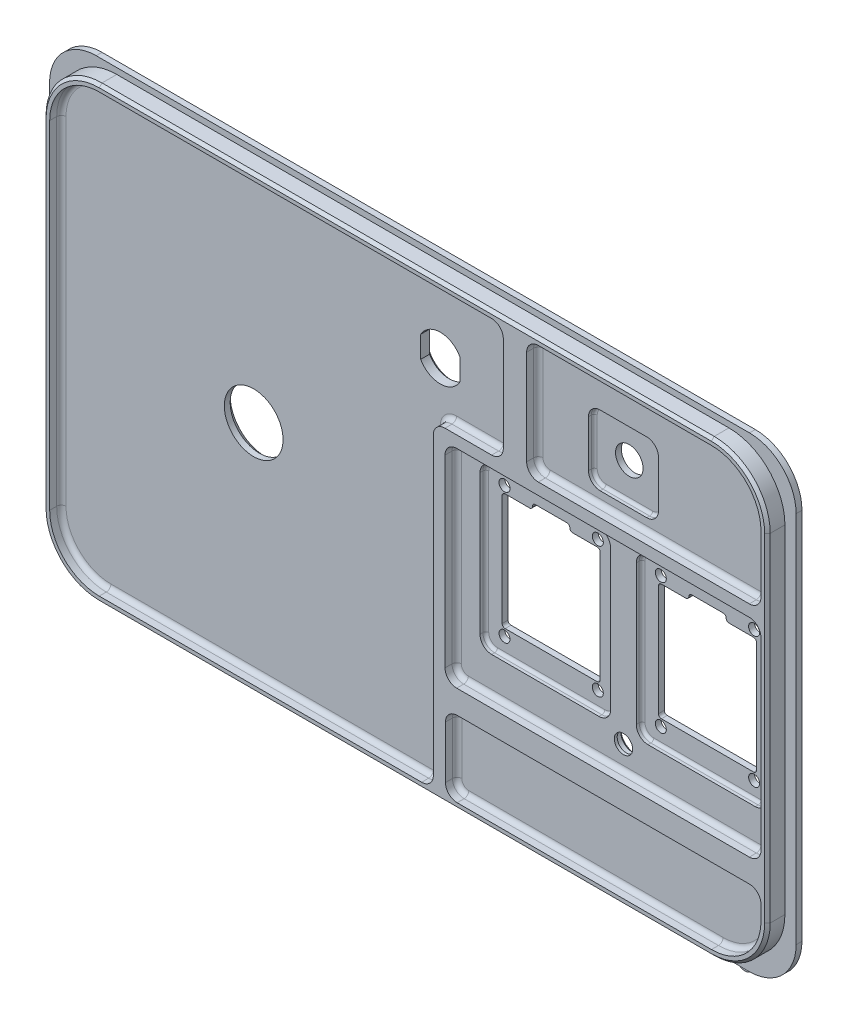
from build123d import *

# Parameters (mm, degrees)
SKETCH2_W           = 203.2
SKETCH2_H           = 127
BOSS_EXTRUDE1_DEPTH = 3.175
SKETCH3_W           = 203.2
SKETCH3_H           = 127
CUT_EXTRUDE1_DEPTH  = 1.5875
FILLET1_R           = 12.7
BOSS_EXTRUDE2_START = 3.175
BOSS_EXTRUDE2_DEPTH = 3.175
SKETCH5_R           = 1.5
SKETCH5_R_2         = 3.75
SKETCH5_R_3         = 2.5
OLED_CUTOUT_DEPTH   = 120.979717036
KEY_SWITCH_DEPTH    = 120.979717036
SKETCH9_R           = 8
SMALL_BUTTON_DEPTH  = 120.979717036
SKETCH10_R          = 3.125
CUT_EXTRUDE4_DEPTH  = 2.38125
SKETCH11_W          = 19.05
SKETCH11_H          = 19.05
CUT_EXTRUDE5_DEPTH  = 1.5875
SKETCH12_W          = 35.56
SKETCH12_H          = 44.45
CUT_EXTRUDE6_DEPTH  = 1.5875
FILLET7_R           = 0.79375
CHAMFER2_SIZE       = 1.5875
FILLET8_R           = 3.175
FILLET9_R           = 0.79375
CHAMFER3_SIZE       = 0.762
SKETCH14_W          = 3.175
SKETCH14_H          = 0.762
BOSS_EXTRUDE3_DEPTH = 1.27
FILLET12_R          = 1.5875
BOSS_EXTRUDE5_DEPTH = 3.175
FILLET13_R          = 3.175
FILLET14_R          = 1.27
CHAMFER4_SIZE       = 0.762
CHAMFER5_SIZE       = 0.762


# Some blends are built 0.0001 mm under size
with BuildPart() as part:
    # Sketch2 → Boss-Extrude1 (new body)
    with BuildSketch(Plane.XY):
        Rectangle(SKETCH2_W, SKETCH2_H)
    extrude(amount=BOSS_EXTRUDE1_DEPTH)

    # Sketch3 → Cut-Extrude1 (cut)
    with BuildSketch(Plane.XY.offset(3.175)):
        Rectangle(SKETCH3_W, SKETCH3_H)
        with BuildLine():
            Line((98.552, -45.212), (98.552, 46.636999944))
            ThreePointArc((98.552, 46.636999944), (94.088307345, 57.413307289), (83.312, 61.876999944))
            Line((83.312, 61.876999944), (-83.312, 61.876999944))
            ThreePointArc((-83.312, 61.876999944), (-94.088307345, 57.413307289), (-98.552, 46.636999944))
            Line((-98.552, 46.636999944), (-98.552, -45.212))
            ThreePointArc((-98.552, -45.212), (-94.088307345, -55.988307345), (-83.312, -60.452))
            Line((-83.312, -60.452), (83.312, -60.452))
            ThreePointArc((83.312, -60.452), (94.088307345, -55.988307345), (98.552, -45.212))
        make_face(mode=Mode.SUBTRACT)
    extrude(amount=-CUT_EXTRUDE1_DEPTH, mode=Mode.SUBTRACT)

    # Fillet1
    fillet1_edges = [part.edges().sort_by_distance(p)[0] for p in [
        (101.6, -63.5, 0.79375),
        (-101.6, -63.5, 0.79375),
        (-101.6, 63.5, 0.79375),
        (101.6, 63.5, 0.79375),
    ]]
    fillet(fillet1_edges, radius=FILLET1_R)

    # Sketch13 → Boss-Extrude2 (add)
    with BuildSketch(Plane.XY.offset(3.175).offset(BOSS_EXTRUDE2_START)):
        with BuildLine():
            Line((98.552, -45.212), (98.552, 46.636999944))
            ThreePointArc((98.552, 46.636999944), (94.088307345, 57.413307289), (83.312, 61.876999944))
            Line((83.312, 61.876999944), (-83.312, 61.876999944))
            ThreePointArc((-83.312, 61.876999944), (-94.088307345, 57.413307289), (-98.552, 46.636999944))
            Line((-98.552, 46.636999944), (-98.552, -45.212))
            ThreePointArc((-98.552, -45.212), (-94.088307345, -55.988307345), (-83.312, -60.452))
            Line((-83.312, -60.452), (83.312, -60.452))
            ThreePointArc((83.312, -60.452), (94.088307345, -55.988307345), (98.552, -45.212))
        make_face()
        with BuildLine():
            Line((96.802, -45.212), (96.802, 46.636999944))
            ThreePointArc((96.802, 46.636999944), (92.850870478, 56.175870422), (83.312, 60.126999944))
            Line((83.312, 60.126999944), (-83.312, 60.126999944))
            ThreePointArc((-83.312, 60.126999944), (-92.850870478, 56.175870422), (-96.802, 46.636999944))
            Line((-96.802, 46.636999944), (-96.802, -45.212))
            ThreePointArc((-96.802, -45.212), (-92.850870478, -54.750870478), (-83.312, -58.702))
            Line((-83.312, -58.702), (83.312, -58.702))
            ThreePointArc((83.312, -58.702), (92.850870478, -54.750870478), (96.802, -45.212))
        make_face(mode=Mode.SUBTRACT)
    extrude(amount=-BOSS_EXTRUDE2_DEPTH)

    # Sketch5 → OLED_CUTOUT (cut, through all)
    with BuildSketch(Plane(origin=(0, 0, 0), x_dir=(-1, 0, 0), z_dir=(0, 0, -1))):
        with Locations((-22.225, -17.78)):
            Circle(SKETCH5_R)
        with Locations((-47.625, -17.78)):
            Circle(SKETCH5_R)
        with Locations((-22.225, 17.78)):
            Circle(SKETCH5_R)
        with Locations((-47.625, 17.78)):
            Circle(SKETCH5_R)
        with Locations((-64.77, -17.78)):
            Circle(SKETCH5_R)
        with Locations((-64.77, 17.78)):
            Circle(SKETCH5_R)
        with Locations((-90.17, -17.78)):
            Circle(SKETCH5_R)
        with Locations((-90.17, 17.78)):
            Circle(SKETCH5_R)
        with Locations((-56.1975, 40.64)):
            Circle(SKETCH5_R_2)
        with Locations((-56.1975, -25.4)):
            Circle(SKETCH5_R_3)
        Polygon((-82.55, 15.875), (-82.55, 17.4625), (-72.39, 17.4625), (-72.39, 15.875), (-64.135, 15.875), (-64.135, -15.875), (-90.805, -15.875), (-90.805, 15.875), align=None)
        Polygon((-48.26, 15.875), (-40.005, 15.875), (-40.005, 17.4625), (-29.845, 17.4625), (-29.845, 15.875), (-21.59, 15.875), (-21.59, -15.875), (-48.26, -15.875), align=None)
    extrude(amount=-OLED_CUTOUT_DEPTH, mode=Mode.SUBTRACT)

    # Sketch8 → Key_switch (cut, through all)
    with BuildSketch(Plane(origin=(0, 0, 0), x_dir=(-1, 0, 0), z_dir=(0, 0, -1))):
        with BuildLine():
            Line((-1.016, 37.68878669), (-1.016, 43.59121331))
            ThreePointArc((-1.016, 43.59121331), (-6.35, 46.736), (-11.684, 43.59121331))
            Line((-11.684, 43.59121331), (-11.684, 37.68878669))
            ThreePointArc((-11.684, 37.68878669), (-6.35, 34.544), (-1.016, 37.68878669))
        make_face()
    extrude(amount=-KEY_SWITCH_DEPTH, mode=Mode.SUBTRACT)

    # Sketch9 → small_button (cut, through all)
    with BuildSketch(Plane.XY):
        with Locations(Location((-44.45, 0, 0), (0, 0, 180))):
            Circle(SKETCH9_R)
    extrude(amount=SMALL_BUTTON_DEPTH, mode=Mode.SUBTRACT)

    # Sketch10 → Cut-Extrude4 (cut)
    with BuildSketch(Plane(origin=(0, 0, 0), x_dir=(-1, 0, 0), z_dir=(0, 0, -1))):
        with Locations((-56.1975, -25.4)):
            Circle(SKETCH10_R)
    extrude(amount=-CUT_EXTRUDE4_DEPTH, mode=Mode.SUBTRACT)

    # Sketch11 → Cut-Extrude5 (cut)
    with BuildSketch(Plane.XY.offset(3.175)):
        with Locations((56.1975, 40.64)):
            Rectangle(SKETCH11_W, SKETCH11_H)
    extrude(amount=-CUT_EXTRUDE5_DEPTH, mode=Mode.SUBTRACT)

    # Sketch12 → Cut-Extrude6 (cut)
    with BuildSketch(Plane.XY.offset(3.175)):
        with Locations((34.925, 0)):
            Rectangle(SKETCH12_W, SKETCH12_H)
        with Locations((77.47, 0)):
            Rectangle(SKETCH12_W, SKETCH12_H)
    extrude(amount=-CUT_EXTRUDE6_DEPTH, mode=Mode.SUBTRACT)

    # Fillet7
    fillet7_edges = [part.edges().sort_by_distance(p)[0] for p in [
        (90.805, 15.875, 0.79375),
        (82.55, 15.875, 0.79375),
        (82.55, 17.4625, 0.79375),
        (64.135, 15.875, 0.79375),
        (72.39, 17.4625, 0.79375),
        (72.39, 15.875, 0.79375),
        (48.26, 15.875, 0.79375),
        (40.005, 17.4625, 0.79375),
        (29.845, 17.4625, 0.79375),
        (21.59, 15.875, 0.79375),
        (40.005, 15.875, 0.79375),
        (29.845, 15.875, 0.79375),
        (21.59, -15.875, 0.79375),
        (48.26, -15.875, 0.79375),
        (64.135, -15.875, 0.79375),
        (90.805, -15.875, 0.79375),
    ]]
    fillet(fillet7_edges, radius=FILLET7_R - 0.0001)  # a hair under: the kernel refuses the full size

    # Chamfer2
    chamfer2_edges = [part.edges().sort_by_distance(p)[0] for p in [
        (-36.45, 0, 0),
    ]]
    chamfer(chamfer2_edges, length=CHAMFER2_SIZE)

    # Fillet8
    fillet8_edges = [part.edges().sort_by_distance(p)[0] for p in [
        (65.7225, 50.165, 2.38125),
        (65.7225, 31.115, 2.38125),
        (46.6725, 31.115, 2.38125),
        (46.6725, 50.165, 2.38125),
        (52.705, 22.225, 2.38125),
        (52.705, -22.225, 2.38125),
        (17.145, -22.225, 2.38125),
        (17.145, 22.225, 2.38125),
        (59.69, -22.225, 2.38125),
        (59.69, 22.225, 2.38125),
        (95.25, 22.225, 2.38125),
        (95.25, -22.225, 2.38125),
    ]]
    fillet(fillet8_edges, radius=FILLET8_R)

    # Fillet9
    fillet9_edges = [part.edges().sort_by_distance(p)[0] for p in [
        (65.7225, 40.64, 1.5875),
        (56.1975, 31.115, 1.5875),
        (56.1975, 50.165, 1.5875),
        (46.6725, 40.64, 1.5875),
        (47.60243597, 49.23506403, 1.5875),
        (64.79256403, 49.23506403, 1.5875),
        (47.60243597, 32.04493597, 1.5875),
        (64.79256403, 32.04493597, 1.5875),
        (77.47, 22.225, 1.5875),
        (95.25, 0, 1.5875),
        (59.69, 0, 1.5875),
        (77.47, -22.225, 1.5875),
        (94.32006403, -21.29506403, 1.5875),
        (60.61993597, -21.29506403, 1.5875),
        (60.61993597, 21.29506403, 1.5875),
        (94.32006403, 21.29506403, 1.5875),
        (52.705, 0, 1.5875),
        (34.925, -22.225, 1.5875),
        (34.925, 22.225, 1.5875),
        (17.145, 0, 1.5875),
        (18.07493597, 21.29506403, 1.5875),
        (51.77506403, 21.29506403, 1.5875),
        (18.07493597, -21.29506403, 1.5875),
        (51.77506403, -21.29506403, 1.5875),
    ]]
    fillet(fillet9_edges, radius=FILLET9_R)

    # Chamfer3
    chamfer3_edges = [part.edges().sort_by_distance(p)[0] for p in [
        (94.088307345, -55.988307345, 6.35),
        (98.552, 0.712499972, 6.35),
        (94.088307345, 57.413307289, 6.35),
        (0, 61.876999944, 6.35),
        (-94.088307345, 57.413307289, 6.35),
        (-98.552, 0.712499972, 6.35),
        (-94.088307345, -55.988307345, 6.35),
        (0, -60.452, 6.35),
    ]]
    chamfer(chamfer3_edges, length=CHAMFER3_SIZE)

    # Sketch14 → Boss-Extrude3 (add)
    with BuildSketch(Plane(origin=(0, 0, 0), x_dir=(-1, 0, 0), z_dir=(0, 0, -1))):
        with Locations((-87.3125, -63.881)):
            Rectangle(SKETCH14_W, SKETCH14_H)
    boss_extrude3 = extrude(amount=-BOSS_EXTRUDE3_DEPTH)

    # Mirror1: Boss-Extrude3 across plane
    add(boss_extrude3.mirror(Plane(origin=(0, 0, 0), x_dir=(0, 0, 1), z_dir=(1, 0, 0))))

    # Fillet12
    # the kernel refuses this fillet: 1.5875 mm, written as the material it takes off along each edge
    with BuildSketch(Plane(origin=(-85.725, -64.262, -3.389972345), x_dir=(0, 1, 0), z_dir=(0, 0, 1)), Plane(origin=(88.9, -64.262, -3.389972345), x_dir=(0, 1, 0), z_dir=(0, 0, 1))) as fillet12_piece_1:
        with BuildLine():
            CenterArc((1.5875, 1.355988938), FILLET12_R, 180, 58.667748502)
            Line((0, 1.355988938), (-0.03175, 1.355988938))
            Line((-0.03175, 1.355988938), (-0.03175, 0))
            Line((-0.03175, 0), (0, -0.03175))
            ThreePointArc((0, -0.03175), (0.381, -0.03175), (0.74549, -0.027119779))
            Line((0.74549, -0.027119779), (0.762, 0))
        make_face()
    extrude(amount=8.04994469, mode=Mode.SUBTRACT)
    with BuildSketch(Plane(origin=(-88.9, -64.262, -3.389972345), x_dir=(0, 1, 0), z_dir=(0, 0, 1)), Plane(origin=(85.725, -64.262, -3.389972345), x_dir=(0, 1, 0), z_dir=(0, 0, 1))) as fillet12_piece_2:
        with BuildLine():
            CenterArc((1.5875, -1.355988938), FILLET12_R, 121.332251498, 58.667748502)
            Line((0, -1.355988938), (-0.03175, -1.355988938))
            Line((-0.03175, -1.355988938), (-0.03175, 0))
            Line((-0.03175, 0), (0, 0.03175))
            ThreePointArc((0, 0.03175), (0.381, 0.03175), (0.74549, 0.027119779))
            Line((0.74549, 0.027119779), (0.762, 0))
        make_face()
    extrude(amount=8.04994469, mode=Mode.SUBTRACT)

    # Sketch15 → Boss-Extrude5 (add)
    with BuildSketch(Plane.XY.offset(3.175)):
        Polygon((96.802, 27.94), (33.02, 27.94), (33.02, 60.126999944), (26.67, 60.126999944), (26.67, 27.94), (7.62, 27.94), (7.62, -58.702), (10.922, -58.702), (10.922, -38.1), (96.802, -38.1), (96.802, -31.75), (10.795, -31.75), (10.795, 24.765), (96.802, 24.765), align=None)
    extrude(amount=BOSS_EXTRUDE5_DEPTH)

    # Fillet13
    fillet13_edges = [part.edges().sort_by_distance(p)[0] for p in [
        (96.802, 24.765, 4.7625),
        (96.802, 27.94, 4.7625),
        (33.02, 27.94, 4.7625),
        (33.02, 60.126999944, 4.7625),
        (26.67, 60.126999944, 4.7625),
        (26.67, 27.94, 4.7625),
        (7.62, 27.94, 4.7625),
        (7.62, -58.702, 4.7625),
        (10.922, -58.702, 4.7625),
        (10.922, -38.1, 4.7625),
        (96.802, -38.1, 4.7625),
        (96.802, -31.75, 4.7625),
        (10.795, -31.75, 4.7625),
        (10.795, 24.765, 4.7625),
    ]]
    fillet(fillet13_edges, radius=FILLET13_R)

    # Fillet14
    fillet14_edges = [part.edges().sort_by_distance(p)[0] for p in [
        (26.67, 44.033499972, 3.175),
        (-29.9085, 60.126999944, 3.175),
        (7.62, -15.381, 3.175),
        (17.145, 27.94, 3.175),
        (25.74006403, 28.86993597, 3.175),
        (25.74006403, 59.197063974, 3.175),
        (6.69006403, -57.77206403, 3.175),
        (10.922, -48.401, 3.175),
        (48.7045, -58.702, 3.175),
        (53.862, -38.1, 3.175),
        (11.85193597, -57.77206403, 3.175),
        (11.85193597, -39.02993597, 3.175),
        (95.87206403, -39.02993597, 3.175),
        (64.911, 27.94, 3.175),
        (96.802, 38.875999972, 3.175),
        (33.02, 44.033499972, 3.175),
        (95.87206403, 28.86993597, 3.175),
        (33.94993597, 28.86993597, 3.175),
        (33.94993597, 59.197063974, 3.175),
        (53.7985, -31.75, 3.175),
        (96.802, -3.4925, 3.175),
        (53.7985, 24.765, 3.175),
        (10.795, -3.4925, 3.175),
        (11.72493597, 23.83506403, 3.175),
        (11.72493597, -30.82006403, 3.175),
        (95.87206403, 23.83506403, 3.175),
        (95.87206403, -30.82006403, 3.175),
        (8.54993597, 27.01006403, 3.175),
        (92.850870478, 56.175870422, 3.175),
        (59.7535, 60.126999944, 3.175),
        (-92.850870478, 56.175870422, 3.175),
        (-96.802, 0.712499972, 3.175),
        (-92.850870478, -54.750870478, 3.175),
        (-39.4335, -58.702, 3.175),
        (92.850870478, -54.750870478, 3.175),
        (96.802, -43.2435, 3.175),
    ]]
    fillet(fillet14_edges, radius=FILLET14_R)

    # Chamfer4
    chamfer4_edges = [part.edges().sort_by_distance(p)[0] for p in [
        (59.3225, -25.4, 0),
    ]]
    chamfer(chamfer4_edges, length=CHAMFER4_SIZE)

    # Chamfer5
    chamfer5_edges = [part.edges().sort_by_distance(p)[0] for p in [
        (6.35, 46.736, 0),
        (11.684, 40.64, 0),
        (6.35, 34.544, 0),
        (1.016, 40.64, 0),
    ]]
    chamfer(chamfer5_edges, length=CHAMFER5_SIZE)


solid = part.part
